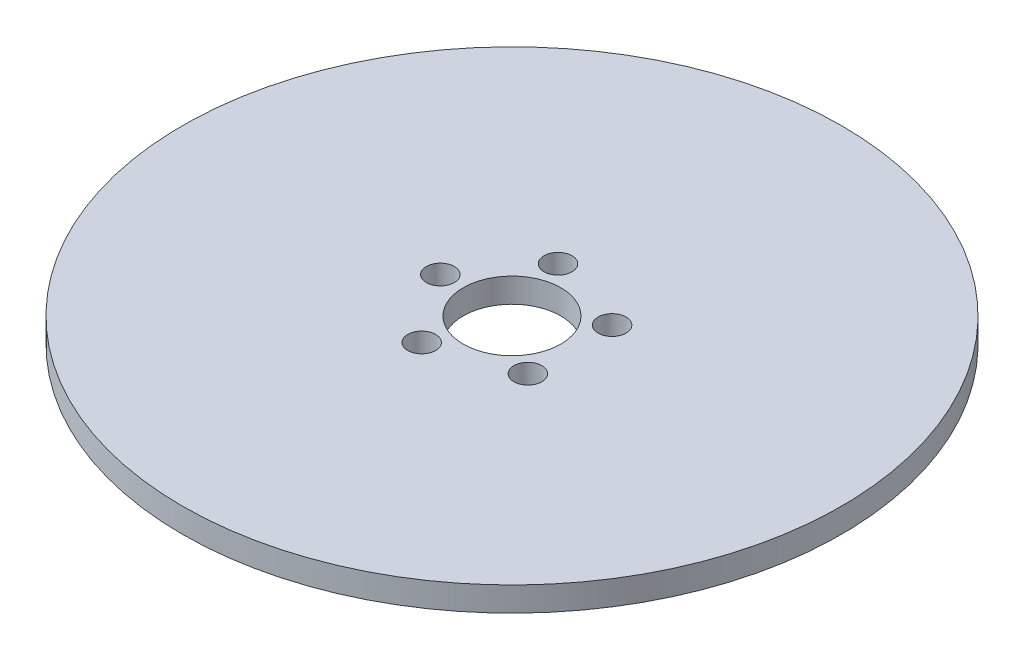
from build123d import *

# Parameters (mm, degrees)
SKETCH1_R           = 67.5
BOSS_EXTRUDE1_DEPTH = 5
SKETCH2_R           = 10
CUT_EXTRUDE1_DEPTH  = 96.590271472
SKETCH3_R           = 2.861508185
CUT_EXTRUDE2_DEPTH  = 4.124754036
CIRPATTERN1_COUNT   = 5


with BuildPart() as part:
    # Sketch1 → Boss-Extrude1 (new body)
    with BuildSketch(Plane(origin=(0, 0, 0), x_dir=(1, 0, 0), z_dir=(0, 1, 0))):
        Circle(SKETCH1_R)
    extrude(amount=BOSS_EXTRUDE1_DEPTH)

    # Sketch2 → Cut-Extrude1 (cut, through all)
    with BuildSketch(Plane(origin=(0, 0, 0), x_dir=(1, 0, 0), z_dir=(0, 1, 0))):
        Circle(SKETCH2_R)
    extrude(amount=CUT_EXTRUDE1_DEPTH, mode=Mode.SUBTRACT)

    # Sketch3 → Cut-Extrude2 (cut)
    with BuildSketch(Plane(origin=(0, 5, 0), x_dir=(1, 0, 0), z_dir=(0, 1, 0))):
        with Locations((-14.676906276, 0)):
            Circle(SKETCH3_R)
    cut_extrude2 = extrude(amount=-CUT_EXTRUDE2_DEPTH, mode=Mode.SUBTRACT)

    # CirPattern1: Cut-Extrude2 ×5 about axis
    cirpattern1_axis = Axis((0, 0, 0), (0, 1, 0))
    for i in range(1, CIRPATTERN1_COUNT):
        add(cut_extrude2.rotate(cirpattern1_axis, i * 360 / CIRPATTERN1_COUNT), mode=Mode.SUBTRACT)


solid = part.part
